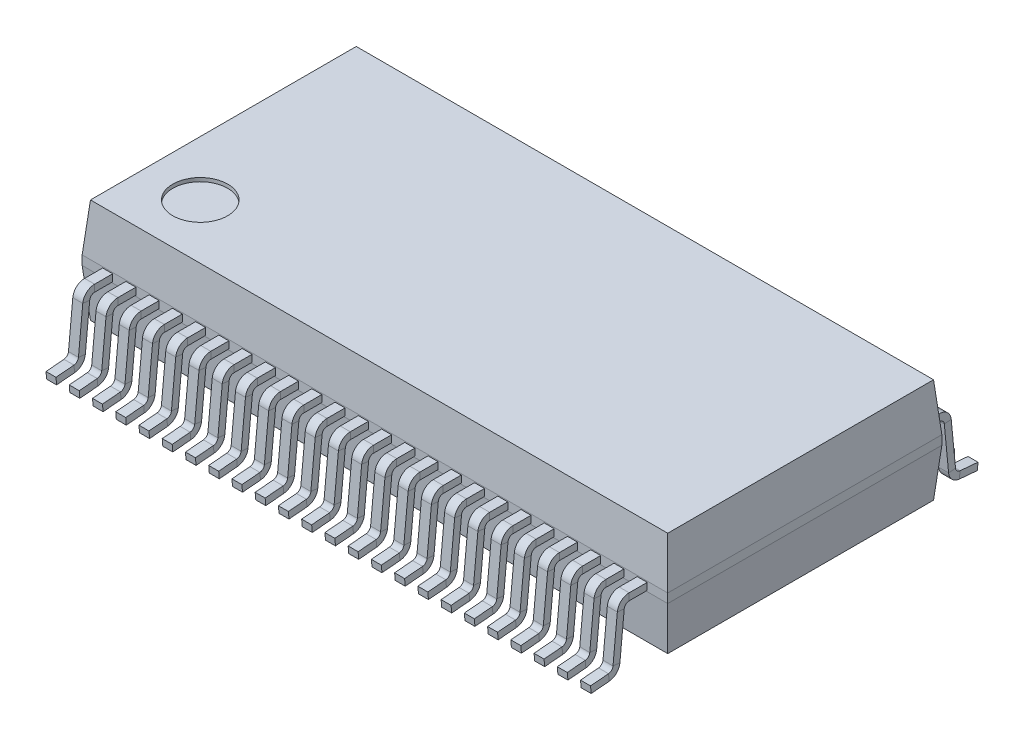
from build123d import *

# Parameters (mm, degrees)
SKETCH1_W                = 16
SKETCH1_H                = 7.49
BOSS_EXTRUDE1_DEPTH      = 0.25
SKETCH2_W                = 16
SKETCH2_H                = 7.49
BOSS_EXTRUDE2_DEPTH      = 1.3
BOSS_EXTRUDE2_TAPER      = 5
SKETCH3_W                = 16
SKETCH3_H                = 7.49
BOSS_EXTRUDE3_DEPTH      = 1.3
BOSS_EXTRUDE3_TAPER      = 5
SKETCH4_W                = 0.273
SKETCH4_H                = 0.19
LPATTERN1_COUNT          = 24
LPATTERN1_PITCH          = 0.635
MIRROR1_COPY_1_SKETCH_W  = 0.273
MIRROR1_COPY_1_SKETCH_H  = 0.19
MIRROR1_COPY_2_SKETCH_W  = 0.273
MIRROR1_COPY_2_SKETCH_H  = 0.19
MIRROR1_COPY_3_SKETCH_W  = 0.273
MIRROR1_COPY_3_SKETCH_H  = 0.19
MIRROR1_COPY_4_SKETCH_W  = 0.273
MIRROR1_COPY_4_SKETCH_H  = 0.19
MIRROR1_COPY_5_SKETCH_W  = 0.273
MIRROR1_COPY_5_SKETCH_H  = 0.19
MIRROR1_COPY_6_SKETCH_W  = 0.273
MIRROR1_COPY_6_SKETCH_H  = 0.19
MIRROR1_COPY_7_SKETCH_W  = 0.273
MIRROR1_COPY_7_SKETCH_H  = 0.19
MIRROR1_COPY_8_SKETCH_W  = 0.273
MIRROR1_COPY_8_SKETCH_H  = 0.19
MIRROR1_COPY_9_SKETCH_W  = 0.273
MIRROR1_COPY_9_SKETCH_H  = 0.19
MIRROR1_COPY_10_SKETCH_W = 0.273
MIRROR1_COPY_10_SKETCH_H = 0.19
MIRROR1_COPY_11_SKETCH_W = 0.273
MIRROR1_COPY_11_SKETCH_H = 0.19
MIRROR1_COPY_12_SKETCH_W = 0.273
MIRROR1_COPY_12_SKETCH_H = 0.19
MIRROR1_COPY_13_SKETCH_W = 0.273
MIRROR1_COPY_13_SKETCH_H = 0.19
MIRROR1_COPY_14_SKETCH_W = 0.273
MIRROR1_COPY_14_SKETCH_H = 0.19
MIRROR1_COPY_15_SKETCH_W = 0.273
MIRROR1_COPY_15_SKETCH_H = 0.19
MIRROR1_COPY_16_SKETCH_W = 0.273
MIRROR1_COPY_16_SKETCH_H = 0.19
MIRROR1_COPY_17_SKETCH_W = 0.273
MIRROR1_COPY_17_SKETCH_H = 0.19
MIRROR1_COPY_18_SKETCH_W = 0.273
MIRROR1_COPY_18_SKETCH_H = 0.19
MIRROR1_COPY_19_SKETCH_W = 0.273
MIRROR1_COPY_19_SKETCH_H = 0.19
MIRROR1_COPY_20_SKETCH_W = 0.273
MIRROR1_COPY_20_SKETCH_H = 0.19
MIRROR1_COPY_21_SKETCH_W = 0.273
MIRROR1_COPY_21_SKETCH_H = 0.19
MIRROR1_COPY_22_SKETCH_W = 0.273
MIRROR1_COPY_22_SKETCH_H = 0.19
MIRROR1_COPY_23_SKETCH_W = 0.273
MIRROR1_COPY_23_SKETCH_H = 0.19
MIRROR1_COPY_24_SKETCH_W = 0.273
MIRROR1_COPY_24_SKETCH_H = 0.19
SKETCH6_R                = 0.75
CUT_EXTRUDE1_DEPTH       = 0.1


with BuildPart() as part:
    # Sketch1 → Boss-Extrude1 (new body)
    with BuildSketch(Plane(origin=(0, 0, 0), x_dir=(1, 0, 0), z_dir=(0, 1, 0))):
        with Locations((8, 3.745)):
            Rectangle(SKETCH1_W, SKETCH1_H)
    extrude(amount=BOSS_EXTRUDE1_DEPTH)

    # Sketch2 → Boss-Extrude2 (add)
    with BuildSketch(Plane(origin=(0, 0.25, 0), x_dir=(1, 0, 0), z_dir=(0, 1, 0))):
        with Locations((8, 3.745)):
            Rectangle(SKETCH2_W, SKETCH2_H)
    extrude(amount=BOSS_EXTRUDE2_DEPTH, taper=BOSS_EXTRUDE2_TAPER)

    # Sketch3 → Boss-Extrude3 (add)
    with BuildSketch(Plane.XZ):
        with Locations((8, -3.745)):
            Rectangle(SKETCH3_W, SKETCH3_H)
    extrude(amount=BOSS_EXTRUDE3_DEPTH, taper=BOSS_EXTRUDE3_TAPER)

    # Sweep1: sweep along a path in Sketch5
    with BuildLine(Plane(origin=(0, 0, 0), x_dir=(0, 0, -1), z_dir=(1, 0, 0))) as sweep1_path:
        Line((0, 0.125), (-0.49305322, 0.125))
        ThreePointArc((-0.49305322, 0.125), (-0.647640924, 0.06530162), (-0.721979624, -0.082803114))
        Line((-0.721979624, -0.082803114), (-0.84, -1.3))
        ThreePointArc((-0.84, -1.3), (-0.907040094, -1.441182497), (-1.0488321, -1.506923648))
        Line((-1.0488321, -1.506923648), (-1.54, -1.55))
    # Sketch4 → Sweep1 (sweep)
    with BuildSketch(Plane.XY):
        with Locations((0.6975, 0.125)):
            Rectangle(SKETCH4_W, SKETCH4_H)
    sweep1 = sweep(path=sweep1_path.line)

    # LPattern1: Sweep1 ×24
    with Locations(*[(i * LPATTERN1_PITCH, 0, 0) for i in range(1, LPATTERN1_COUNT)]):
        add(sweep1)

    # Mirror1 copy 1: sweep along a path in Mirror1 copy 1 path
    with BuildLine(Plane(origin=(0.635, 0, -7.49), x_dir=(0, 0, 1), z_dir=(1, 0, 0))) as mirror1_copy_1_path:
        Line((0, -0.125), (-0.49305322, -0.125))
        ThreePointArc((-0.49305322, -0.125), (-0.647640924, -0.06530162), (-0.721979624, 0.082803114))
        Line((-0.721979624, 0.082803114), (-0.84, 1.3))
        ThreePointArc((-0.84, 1.3), (-0.907040094, 1.441182497), (-1.0488321, 1.506923648))
        Line((-1.0488321, 1.506923648), (-1.54, 1.55))
    # Mirror1 copy 1 sketch → Mirror1 copy 1 (sweep)
    with BuildSketch(Plane(origin=(0.635, 0, -7.49), x_dir=(1, 0, 0), z_dir=(0, 0, -1))):
        with Locations((0.6975, -0.125)):
            Rectangle(MIRROR1_COPY_1_SKETCH_W, MIRROR1_COPY_1_SKETCH_H)
    sweep(path=mirror1_copy_1_path.line)

    # Mirror1 copy 2: sweep along a path in Mirror1 copy 2 path
    with BuildLine(Plane(origin=(1.27, 0, -7.49), x_dir=(0, 0, 1), z_dir=(1, 0, 0))) as mirror1_copy_2_path:
        Line((0, -0.125), (-0.49305322, -0.125))
        ThreePointArc((-0.49305322, -0.125), (-0.647640924, -0.06530162), (-0.721979624, 0.082803114))
        Line((-0.721979624, 0.082803114), (-0.84, 1.3))
        ThreePointArc((-0.84, 1.3), (-0.907040094, 1.441182497), (-1.0488321, 1.506923648))
        Line((-1.0488321, 1.506923648), (-1.54, 1.55))
    # Mirror1 copy 2 sketch → Mirror1 copy 2 (sweep)
    with BuildSketch(Plane(origin=(1.27, 0, -7.49), x_dir=(1, 0, 0), z_dir=(0, 0, -1))):
        with Locations((0.6975, -0.125)):
            Rectangle(MIRROR1_COPY_2_SKETCH_W, MIRROR1_COPY_2_SKETCH_H)
    sweep(path=mirror1_copy_2_path.line)

    # Mirror1 copy 3: sweep along a path in Mirror1 copy 3 path
    with BuildLine(Plane(origin=(1.905, 0, -7.49), x_dir=(0, 0, 1), z_dir=(1, 0, 0))) as mirror1_copy_3_path:
        Line((0, -0.125), (-0.49305322, -0.125))
        ThreePointArc((-0.49305322, -0.125), (-0.647640924, -0.06530162), (-0.721979624, 0.082803114))
        Line((-0.721979624, 0.082803114), (-0.84, 1.3))
        ThreePointArc((-0.84, 1.3), (-0.907040094, 1.441182497), (-1.0488321, 1.506923648))
        Line((-1.0488321, 1.506923648), (-1.54, 1.55))
    # Mirror1 copy 3 sketch → Mirror1 copy 3 (sweep)
    with BuildSketch(Plane(origin=(1.905, 0, -7.49), x_dir=(1, 0, 0), z_dir=(0, 0, -1))):
        with Locations((0.6975, -0.125)):
            Rectangle(MIRROR1_COPY_3_SKETCH_W, MIRROR1_COPY_3_SKETCH_H)
    sweep(path=mirror1_copy_3_path.line)

    # Mirror1 copy 4: sweep along a path in Mirror1 copy 4 path
    with BuildLine(Plane(origin=(2.54, 0, -7.49), x_dir=(0, 0, 1), z_dir=(1, 0, 0))) as mirror1_copy_4_path:
        Line((0, -0.125), (-0.49305322, -0.125))
        ThreePointArc((-0.49305322, -0.125), (-0.647640924, -0.06530162), (-0.721979624, 0.082803114))
        Line((-0.721979624, 0.082803114), (-0.84, 1.3))
        ThreePointArc((-0.84, 1.3), (-0.907040094, 1.441182497), (-1.0488321, 1.506923648))
        Line((-1.0488321, 1.506923648), (-1.54, 1.55))
    # Mirror1 copy 4 sketch → Mirror1 copy 4 (sweep)
    with BuildSketch(Plane(origin=(2.54, 0, -7.49), x_dir=(1, 0, 0), z_dir=(0, 0, -1))):
        with Locations((0.6975, -0.125)):
            Rectangle(MIRROR1_COPY_4_SKETCH_W, MIRROR1_COPY_4_SKETCH_H)
    sweep(path=mirror1_copy_4_path.line)

    # Mirror1 copy 5: sweep along a path in Mirror1 copy 5 path
    with BuildLine(Plane(origin=(3.175, 0, -7.49), x_dir=(0, 0, 1), z_dir=(1, 0, 0))) as mirror1_copy_5_path:
        Line((0, -0.125), (-0.49305322, -0.125))
        ThreePointArc((-0.49305322, -0.125), (-0.647640924, -0.06530162), (-0.721979624, 0.082803114))
        Line((-0.721979624, 0.082803114), (-0.84, 1.3))
        ThreePointArc((-0.84, 1.3), (-0.907040094, 1.441182497), (-1.0488321, 1.506923648))
        Line((-1.0488321, 1.506923648), (-1.54, 1.55))
    # Mirror1 copy 5 sketch → Mirror1 copy 5 (sweep)
    with BuildSketch(Plane(origin=(3.175, 0, -7.49), x_dir=(1, 0, 0), z_dir=(0, 0, -1))):
        with Locations((0.6975, -0.125)):
            Rectangle(MIRROR1_COPY_5_SKETCH_W, MIRROR1_COPY_5_SKETCH_H)
    sweep(path=mirror1_copy_5_path.line)

    # Mirror1 copy 6: sweep along a path in Mirror1 copy 6 path
    with BuildLine(Plane(origin=(3.81, 0, -7.49), x_dir=(0, 0, 1), z_dir=(1, 0, 0))) as mirror1_copy_6_path:
        Line((0, -0.125), (-0.49305322, -0.125))
        ThreePointArc((-0.49305322, -0.125), (-0.647640924, -0.06530162), (-0.721979624, 0.082803114))
        Line((-0.721979624, 0.082803114), (-0.84, 1.3))
        ThreePointArc((-0.84, 1.3), (-0.907040094, 1.441182497), (-1.0488321, 1.506923648))
        Line((-1.0488321, 1.506923648), (-1.54, 1.55))
    # Mirror1 copy 6 sketch → Mirror1 copy 6 (sweep)
    with BuildSketch(Plane(origin=(3.81, 0, -7.49), x_dir=(1, 0, 0), z_dir=(0, 0, -1))):
        with Locations((0.6975, -0.125)):
            Rectangle(MIRROR1_COPY_6_SKETCH_W, MIRROR1_COPY_6_SKETCH_H)
    sweep(path=mirror1_copy_6_path.line)

    # Mirror1 copy 7: sweep along a path in Mirror1 copy 7 path
    with BuildLine(Plane(origin=(4.445, 0, -7.49), x_dir=(0, 0, 1), z_dir=(1, 0, 0))) as mirror1_copy_7_path:
        Line((0, -0.125), (-0.49305322, -0.125))
        ThreePointArc((-0.49305322, -0.125), (-0.647640924, -0.06530162), (-0.721979624, 0.082803114))
        Line((-0.721979624, 0.082803114), (-0.84, 1.3))
        ThreePointArc((-0.84, 1.3), (-0.907040094, 1.441182497), (-1.0488321, 1.506923648))
        Line((-1.0488321, 1.506923648), (-1.54, 1.55))
    # Mirror1 copy 7 sketch → Mirror1 copy 7 (sweep)
    with BuildSketch(Plane(origin=(4.445, 0, -7.49), x_dir=(1, 0, 0), z_dir=(0, 0, -1))):
        with Locations((0.6975, -0.125)):
            Rectangle(MIRROR1_COPY_7_SKETCH_W, MIRROR1_COPY_7_SKETCH_H)
    sweep(path=mirror1_copy_7_path.line)

    # Mirror1 copy 8: sweep along a path in Mirror1 copy 8 path
    with BuildLine(Plane(origin=(5.08, 0, -7.49), x_dir=(0, 0, 1), z_dir=(1, 0, 0))) as mirror1_copy_8_path:
        Line((0, -0.125), (-0.49305322, -0.125))
        ThreePointArc((-0.49305322, -0.125), (-0.647640924, -0.06530162), (-0.721979624, 0.082803114))
        Line((-0.721979624, 0.082803114), (-0.84, 1.3))
        ThreePointArc((-0.84, 1.3), (-0.907040094, 1.441182497), (-1.0488321, 1.506923648))
        Line((-1.0488321, 1.506923648), (-1.54, 1.55))
    # Mirror1 copy 8 sketch → Mirror1 copy 8 (sweep)
    with BuildSketch(Plane(origin=(5.08, 0, -7.49), x_dir=(1, 0, 0), z_dir=(0, 0, -1))):
        with Locations((0.6975, -0.125)):
            Rectangle(MIRROR1_COPY_8_SKETCH_W, MIRROR1_COPY_8_SKETCH_H)
    sweep(path=mirror1_copy_8_path.line)

    # Mirror1 copy 9: sweep along a path in Mirror1 copy 9 path
    with BuildLine(Plane(origin=(5.715, 0, -7.49), x_dir=(0, 0, 1), z_dir=(1, 0, 0))) as mirror1_copy_9_path:
        Line((0, -0.125), (-0.49305322, -0.125))
        ThreePointArc((-0.49305322, -0.125), (-0.647640924, -0.06530162), (-0.721979624, 0.082803114))
        Line((-0.721979624, 0.082803114), (-0.84, 1.3))
        ThreePointArc((-0.84, 1.3), (-0.907040094, 1.441182497), (-1.0488321, 1.506923648))
        Line((-1.0488321, 1.506923648), (-1.54, 1.55))
    # Mirror1 copy 9 sketch → Mirror1 copy 9 (sweep)
    with BuildSketch(Plane(origin=(5.715, 0, -7.49), x_dir=(1, 0, 0), z_dir=(0, 0, -1))):
        with Locations((0.6975, -0.125)):
            Rectangle(MIRROR1_COPY_9_SKETCH_W, MIRROR1_COPY_9_SKETCH_H)
    sweep(path=mirror1_copy_9_path.line)

    # Mirror1 copy 10: sweep along a path in Mirror1 copy 10 path
    with BuildLine(Plane(origin=(6.35, 0, -7.49), x_dir=(0, 0, 1), z_dir=(1, 0, 0))) as mirror1_copy_10_path:
        Line((0, -0.125), (-0.49305322, -0.125))
        ThreePointArc((-0.49305322, -0.125), (-0.647640924, -0.06530162), (-0.721979624, 0.082803114))
        Line((-0.721979624, 0.082803114), (-0.84, 1.3))
        ThreePointArc((-0.84, 1.3), (-0.907040094, 1.441182497), (-1.0488321, 1.506923648))
        Line((-1.0488321, 1.506923648), (-1.54, 1.55))
    # Mirror1 copy 10 sketch → Mirror1 copy 10 (sweep)
    with BuildSketch(Plane(origin=(6.35, 0, -7.49), x_dir=(1, 0, 0), z_dir=(0, 0, -1))):
        with Locations((0.6975, -0.125)):
            Rectangle(MIRROR1_COPY_10_SKETCH_W, MIRROR1_COPY_10_SKETCH_H)
    sweep(path=mirror1_copy_10_path.line)

    # Mirror1 copy 11: sweep along a path in Mirror1 copy 11 path
    with BuildLine(Plane(origin=(6.985, 0, -7.49), x_dir=(0, 0, 1), z_dir=(1, 0, 0))) as mirror1_copy_11_path:
        Line((0, -0.125), (-0.49305322, -0.125))
        ThreePointArc((-0.49305322, -0.125), (-0.647640924, -0.06530162), (-0.721979624, 0.082803114))
        Line((-0.721979624, 0.082803114), (-0.84, 1.3))
        ThreePointArc((-0.84, 1.3), (-0.907040094, 1.441182497), (-1.0488321, 1.506923648))
        Line((-1.0488321, 1.506923648), (-1.54, 1.55))
    # Mirror1 copy 11 sketch → Mirror1 copy 11 (sweep)
    with BuildSketch(Plane(origin=(6.985, 0, -7.49), x_dir=(1, 0, 0), z_dir=(0, 0, -1))):
        with Locations((0.6975, -0.125)):
            Rectangle(MIRROR1_COPY_11_SKETCH_W, MIRROR1_COPY_11_SKETCH_H)
    sweep(path=mirror1_copy_11_path.line)

    # Mirror1 copy 12: sweep along a path in Mirror1 copy 12 path
    with BuildLine(Plane(origin=(7.62, 0, -7.49), x_dir=(0, 0, 1), z_dir=(1, 0, 0))) as mirror1_copy_12_path:
        Line((0, -0.125), (-0.49305322, -0.125))
        ThreePointArc((-0.49305322, -0.125), (-0.647640924, -0.06530162), (-0.721979624, 0.082803114))
        Line((-0.721979624, 0.082803114), (-0.84, 1.3))
        ThreePointArc((-0.84, 1.3), (-0.907040094, 1.441182497), (-1.0488321, 1.506923648))
        Line((-1.0488321, 1.506923648), (-1.54, 1.55))
    # Mirror1 copy 12 sketch → Mirror1 copy 12 (sweep)
    with BuildSketch(Plane(origin=(7.62, 0, -7.49), x_dir=(1, 0, 0), z_dir=(0, 0, -1))):
        with Locations((0.6975, -0.125)):
            Rectangle(MIRROR1_COPY_12_SKETCH_W, MIRROR1_COPY_12_SKETCH_H)
    sweep(path=mirror1_copy_12_path.line)

    # Mirror1 copy 13: sweep along a path in Mirror1 copy 13 path
    with BuildLine(Plane(origin=(8.255, 0, -7.49), x_dir=(0, 0, 1), z_dir=(1, 0, 0))) as mirror1_copy_13_path:
        Line((0, -0.125), (-0.49305322, -0.125))
        ThreePointArc((-0.49305322, -0.125), (-0.647640924, -0.06530162), (-0.721979624, 0.082803114))
        Line((-0.721979624, 0.082803114), (-0.84, 1.3))
        ThreePointArc((-0.84, 1.3), (-0.907040094, 1.441182497), (-1.0488321, 1.506923648))
        Line((-1.0488321, 1.506923648), (-1.54, 1.55))
    # Mirror1 copy 13 sketch → Mirror1 copy 13 (sweep)
    with BuildSketch(Plane(origin=(8.255, 0, -7.49), x_dir=(1, 0, 0), z_dir=(0, 0, -1))):
        with Locations((0.6975, -0.125)):
            Rectangle(MIRROR1_COPY_13_SKETCH_W, MIRROR1_COPY_13_SKETCH_H)
    sweep(path=mirror1_copy_13_path.line)

    # Mirror1 copy 14: sweep along a path in Mirror1 copy 14 path
    with BuildLine(Plane(origin=(8.89, 0, -7.49), x_dir=(0, 0, 1), z_dir=(1, 0, 0))) as mirror1_copy_14_path:
        Line((0, -0.125), (-0.49305322, -0.125))
        ThreePointArc((-0.49305322, -0.125), (-0.647640924, -0.06530162), (-0.721979624, 0.082803114))
        Line((-0.721979624, 0.082803114), (-0.84, 1.3))
        ThreePointArc((-0.84, 1.3), (-0.907040094, 1.441182497), (-1.0488321, 1.506923648))
        Line((-1.0488321, 1.506923648), (-1.54, 1.55))
    # Mirror1 copy 14 sketch → Mirror1 copy 14 (sweep)
    with BuildSketch(Plane(origin=(8.89, 0, -7.49), x_dir=(1, 0, 0), z_dir=(0, 0, -1))):
        with Locations((0.6975, -0.125)):
            Rectangle(MIRROR1_COPY_14_SKETCH_W, MIRROR1_COPY_14_SKETCH_H)
    sweep(path=mirror1_copy_14_path.line)

    # Mirror1 copy 15: sweep along a path in Mirror1 copy 15 path
    with BuildLine(Plane(origin=(9.525, 0, -7.49), x_dir=(0, 0, 1), z_dir=(1, 0, 0))) as mirror1_copy_15_path:
        Line((0, -0.125), (-0.49305322, -0.125))
        ThreePointArc((-0.49305322, -0.125), (-0.647640924, -0.06530162), (-0.721979624, 0.082803114))
        Line((-0.721979624, 0.082803114), (-0.84, 1.3))
        ThreePointArc((-0.84, 1.3), (-0.907040094, 1.441182497), (-1.0488321, 1.506923648))
        Line((-1.0488321, 1.506923648), (-1.54, 1.55))
    # Mirror1 copy 15 sketch → Mirror1 copy 15 (sweep)
    with BuildSketch(Plane(origin=(9.525, 0, -7.49), x_dir=(1, 0, 0), z_dir=(0, 0, -1))):
        with Locations((0.6975, -0.125)):
            Rectangle(MIRROR1_COPY_15_SKETCH_W, MIRROR1_COPY_15_SKETCH_H)
    sweep(path=mirror1_copy_15_path.line)

    # Mirror1 copy 16: sweep along a path in Mirror1 copy 16 path
    with BuildLine(Plane(origin=(10.16, 0, -7.49), x_dir=(0, 0, 1), z_dir=(1, 0, 0))) as mirror1_copy_16_path:
        Line((0, -0.125), (-0.49305322, -0.125))
        ThreePointArc((-0.49305322, -0.125), (-0.647640924, -0.06530162), (-0.721979624, 0.082803114))
        Line((-0.721979624, 0.082803114), (-0.84, 1.3))
        ThreePointArc((-0.84, 1.3), (-0.907040094, 1.441182497), (-1.0488321, 1.506923648))
        Line((-1.0488321, 1.506923648), (-1.54, 1.55))
    # Mirror1 copy 16 sketch → Mirror1 copy 16 (sweep)
    with BuildSketch(Plane(origin=(10.16, 0, -7.49), x_dir=(1, 0, 0), z_dir=(0, 0, -1))):
        with Locations((0.6975, -0.125)):
            Rectangle(MIRROR1_COPY_16_SKETCH_W, MIRROR1_COPY_16_SKETCH_H)
    sweep(path=mirror1_copy_16_path.line)

    # Mirror1 copy 17: sweep along a path in Mirror1 copy 17 path
    with BuildLine(Plane(origin=(10.795, 0, -7.49), x_dir=(0, 0, 1), z_dir=(1, 0, 0))) as mirror1_copy_17_path:
        Line((0, -0.125), (-0.49305322, -0.125))
        ThreePointArc((-0.49305322, -0.125), (-0.647640924, -0.06530162), (-0.721979624, 0.082803114))
        Line((-0.721979624, 0.082803114), (-0.84, 1.3))
        ThreePointArc((-0.84, 1.3), (-0.907040094, 1.441182497), (-1.0488321, 1.506923648))
        Line((-1.0488321, 1.506923648), (-1.54, 1.55))
    # Mirror1 copy 17 sketch → Mirror1 copy 17 (sweep)
    with BuildSketch(Plane(origin=(10.795, 0, -7.49), x_dir=(1, 0, 0), z_dir=(0, 0, -1))):
        with Locations((0.6975, -0.125)):
            Rectangle(MIRROR1_COPY_17_SKETCH_W, MIRROR1_COPY_17_SKETCH_H)
    sweep(path=mirror1_copy_17_path.line)

    # Mirror1 copy 18: sweep along a path in Mirror1 copy 18 path
    with BuildLine(Plane(origin=(11.43, 0, -7.49), x_dir=(0, 0, 1), z_dir=(1, 0, 0))) as mirror1_copy_18_path:
        Line((0, -0.125), (-0.49305322, -0.125))
        ThreePointArc((-0.49305322, -0.125), (-0.647640924, -0.06530162), (-0.721979624, 0.082803114))
        Line((-0.721979624, 0.082803114), (-0.84, 1.3))
        ThreePointArc((-0.84, 1.3), (-0.907040094, 1.441182497), (-1.0488321, 1.506923648))
        Line((-1.0488321, 1.506923648), (-1.54, 1.55))
    # Mirror1 copy 18 sketch → Mirror1 copy 18 (sweep)
    with BuildSketch(Plane(origin=(11.43, 0, -7.49), x_dir=(1, 0, 0), z_dir=(0, 0, -1))):
        with Locations((0.6975, -0.125)):
            Rectangle(MIRROR1_COPY_18_SKETCH_W, MIRROR1_COPY_18_SKETCH_H)
    sweep(path=mirror1_copy_18_path.line)

    # Mirror1 copy 19: sweep along a path in Mirror1 copy 19 path
    with BuildLine(Plane(origin=(12.065, 0, -7.49), x_dir=(0, 0, 1), z_dir=(1, 0, 0))) as mirror1_copy_19_path:
        Line((0, -0.125), (-0.49305322, -0.125))
        ThreePointArc((-0.49305322, -0.125), (-0.647640924, -0.06530162), (-0.721979624, 0.082803114))
        Line((-0.721979624, 0.082803114), (-0.84, 1.3))
        ThreePointArc((-0.84, 1.3), (-0.907040094, 1.441182497), (-1.0488321, 1.506923648))
        Line((-1.0488321, 1.506923648), (-1.54, 1.55))
    # Mirror1 copy 19 sketch → Mirror1 copy 19 (sweep)
    with BuildSketch(Plane(origin=(12.065, 0, -7.49), x_dir=(1, 0, 0), z_dir=(0, 0, -1))):
        with Locations((0.6975, -0.125)):
            Rectangle(MIRROR1_COPY_19_SKETCH_W, MIRROR1_COPY_19_SKETCH_H)
    sweep(path=mirror1_copy_19_path.line)

    # Mirror1 copy 20: sweep along a path in Mirror1 copy 20 path
    with BuildLine(Plane(origin=(12.7, 0, -7.49), x_dir=(0, 0, 1), z_dir=(1, 0, 0))) as mirror1_copy_20_path:
        Line((0, -0.125), (-0.49305322, -0.125))
        ThreePointArc((-0.49305322, -0.125), (-0.647640924, -0.06530162), (-0.721979624, 0.082803114))
        Line((-0.721979624, 0.082803114), (-0.84, 1.3))
        ThreePointArc((-0.84, 1.3), (-0.907040094, 1.441182497), (-1.0488321, 1.506923648))
        Line((-1.0488321, 1.506923648), (-1.54, 1.55))
    # Mirror1 copy 20 sketch → Mirror1 copy 20 (sweep)
    with BuildSketch(Plane(origin=(12.7, 0, -7.49), x_dir=(1, 0, 0), z_dir=(0, 0, -1))):
        with Locations((0.6975, -0.125)):
            Rectangle(MIRROR1_COPY_20_SKETCH_W, MIRROR1_COPY_20_SKETCH_H)
    sweep(path=mirror1_copy_20_path.line)

    # Mirror1 copy 21: sweep along a path in Mirror1 copy 21 path
    with BuildLine(Plane(origin=(13.335, 0, -7.49), x_dir=(0, 0, 1), z_dir=(1, 0, 0))) as mirror1_copy_21_path:
        Line((0, -0.125), (-0.49305322, -0.125))
        ThreePointArc((-0.49305322, -0.125), (-0.647640924, -0.06530162), (-0.721979624, 0.082803114))
        Line((-0.721979624, 0.082803114), (-0.84, 1.3))
        ThreePointArc((-0.84, 1.3), (-0.907040094, 1.441182497), (-1.0488321, 1.506923648))
        Line((-1.0488321, 1.506923648), (-1.54, 1.55))
    # Mirror1 copy 21 sketch → Mirror1 copy 21 (sweep)
    with BuildSketch(Plane(origin=(13.335, 0, -7.49), x_dir=(1, 0, 0), z_dir=(0, 0, -1))):
        with Locations((0.6975, -0.125)):
            Rectangle(MIRROR1_COPY_21_SKETCH_W, MIRROR1_COPY_21_SKETCH_H)
    sweep(path=mirror1_copy_21_path.line)

    # Mirror1 copy 22: sweep along a path in Mirror1 copy 22 path
    with BuildLine(Plane(origin=(13.97, 0, -7.49), x_dir=(0, 0, 1), z_dir=(1, 0, 0))) as mirror1_copy_22_path:
        Line((0, -0.125), (-0.49305322, -0.125))
        ThreePointArc((-0.49305322, -0.125), (-0.647640924, -0.06530162), (-0.721979624, 0.082803114))
        Line((-0.721979624, 0.082803114), (-0.84, 1.3))
        ThreePointArc((-0.84, 1.3), (-0.907040094, 1.441182497), (-1.0488321, 1.506923648))
        Line((-1.0488321, 1.506923648), (-1.54, 1.55))
    # Mirror1 copy 22 sketch → Mirror1 copy 22 (sweep)
    with BuildSketch(Plane(origin=(13.97, 0, -7.49), x_dir=(1, 0, 0), z_dir=(0, 0, -1))):
        with Locations((0.6975, -0.125)):
            Rectangle(MIRROR1_COPY_22_SKETCH_W, MIRROR1_COPY_22_SKETCH_H)
    sweep(path=mirror1_copy_22_path.line)

    # Mirror1 copy 23: sweep along a path in Mirror1 copy 23 path
    with BuildLine(Plane(origin=(14.605, 0, -7.49), x_dir=(0, 0, 1), z_dir=(1, 0, 0))) as mirror1_copy_23_path:
        Line((0, -0.125), (-0.49305322, -0.125))
        ThreePointArc((-0.49305322, -0.125), (-0.647640924, -0.06530162), (-0.721979624, 0.082803114))
        Line((-0.721979624, 0.082803114), (-0.84, 1.3))
        ThreePointArc((-0.84, 1.3), (-0.907040094, 1.441182497), (-1.0488321, 1.506923648))
        Line((-1.0488321, 1.506923648), (-1.54, 1.55))
    # Mirror1 copy 23 sketch → Mirror1 copy 23 (sweep)
    with BuildSketch(Plane(origin=(14.605, 0, -7.49), x_dir=(1, 0, 0), z_dir=(0, 0, -1))):
        with Locations((0.6975, -0.125)):
            Rectangle(MIRROR1_COPY_23_SKETCH_W, MIRROR1_COPY_23_SKETCH_H)
    sweep(path=mirror1_copy_23_path.line)

    # Mirror1 copy 24: sweep along a path in Mirror1 copy 24 path
    with BuildLine(Plane(origin=(0, 0, -7.49), x_dir=(0, 0, 1), z_dir=(1, 0, 0))) as mirror1_copy_24_path:
        Line((0, -0.125), (-0.49305322, -0.125))
        ThreePointArc((-0.49305322, -0.125), (-0.647640924, -0.06530162), (-0.721979624, 0.082803114))
        Line((-0.721979624, 0.082803114), (-0.84, 1.3))
        ThreePointArc((-0.84, 1.3), (-0.907040094, 1.441182497), (-1.0488321, 1.506923648))
        Line((-1.0488321, 1.506923648), (-1.54, 1.55))
    # Mirror1 copy 24 sketch → Mirror1 copy 24 (sweep)
    with BuildSketch(Plane(origin=(0, 0, -7.49), x_dir=(1, 0, 0), z_dir=(0, 0, -1))):
        with Locations((0.6975, -0.125)):
            Rectangle(MIRROR1_COPY_24_SKETCH_W, MIRROR1_COPY_24_SKETCH_H)
    sweep(path=mirror1_copy_24_path.line)

    # Sketch6 → Cut-Extrude1 (cut)
    with BuildSketch(Plane(origin=(0, 1.55, 0), x_dir=(1, 0, 0), z_dir=(0, 1, 0))):
        with Locations((1.613735263, 1.613735263)):
            Circle(SKETCH6_R)
    extrude(amount=-CUT_EXTRUDE1_DEPTH, mode=Mode.SUBTRACT)


solid = part.part
